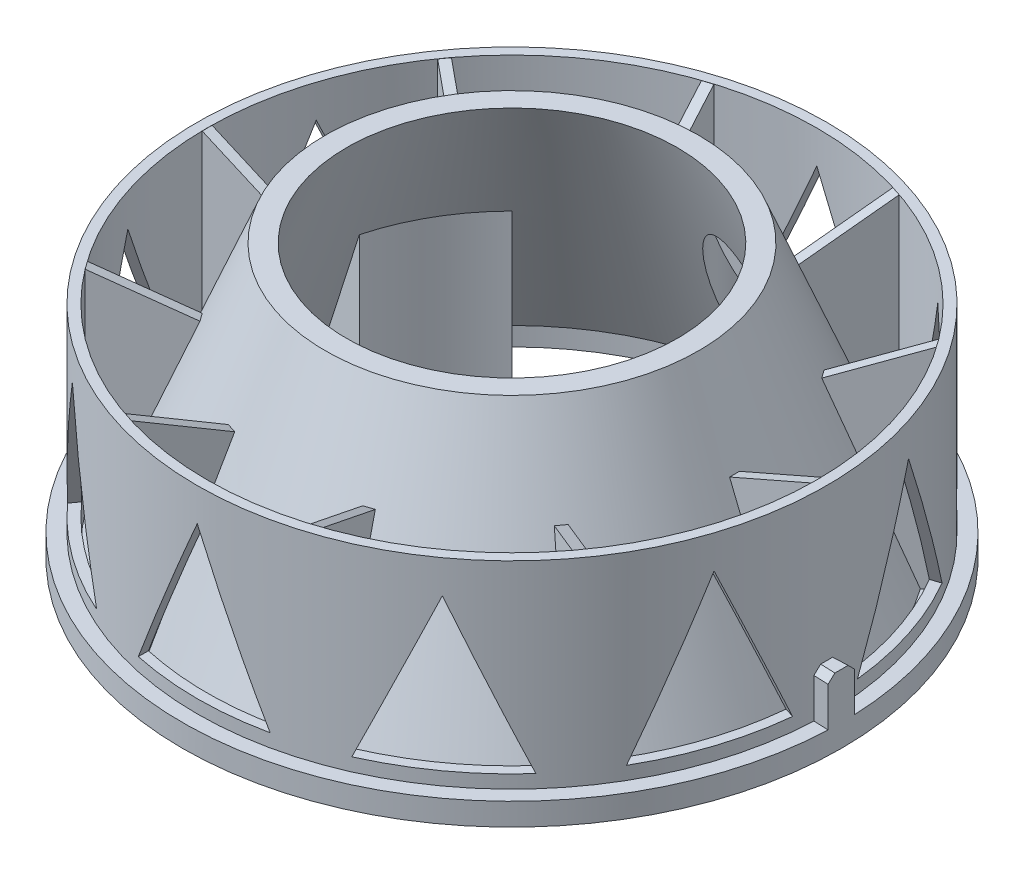
from build123d import *

# Parameters (mm, degrees)
EXTRUDE_771_DEPTH                    = 0.75
PATTERN_CIRCULAR_830_COUNT           = 10
CUT_EXTRUDE_966_DEPTH                = 37.9
CUT_EXTRUDE_966_DEPTH_BACK           = 24.5
SKETCH_3_R                           = 5
CUT_EXTRUDE_1424_DEPTH               = 3
PATTERN_CIRCULAR_2_COUNT             = 6
CUT_EXTRUDE_START                    = 45.15598
CUT_EXTRUDE_1_DEPTH                  = 2.59402
PATTERN_CIRCULAR_3_COUNT             = 10
EXTRUDE_1_DEPTH                      = 7
CHAMFER_1_SIZE                       = 1
SKETCH_8_R                           = 50
SKETCH_8_R_2                         = 45
CUT_EXTRUDE_2_DEPTH                  = 1.6
EXTRUDE_2_REACH                      = 83.24
PATTERN_CIRCULAR_4_COUNT             = 3
SKETCH_10_R                          = 2.2
CUT_EXTRUDE_3_DEPTH                  = 12
CHAMFER_2_SIZE                       = 1
PATTERN_CIRCULAR_5_COUNT             = 3
CHAMFER_2_OF_PATTERN_CIRCULAR_5_SIZE = 1
CHAMFER_3_SIZE                       = 0.4


with BuildPart() as part:
    # Эскиз1 → Повернуть1 (revolve)
    with BuildSketch(Plane.XY, mode=Mode.PRIVATE) as revolve_1_sk:
        Polygon((46.25, 35), (47.75, 35), (47.75, 5), (50, 5), (50, 0), (32.75, 0), (32.75, 3), (41.25, 3), (25.088950967, 43), (28.324555195, 43), (44.485604228, 3), (46.25, 3), align=None)
    revolve(revolve_1_sk.sketch.rotate(Axis((0, 0, 0), (0, 1, 0)), 90), axis=Axis((0, 0, 0), (0, 1, 0)))

    # Эскиз2 → Extrude 771 (add, symmetric)
    with BuildSketch(Plane.XY):
        Polygon((46.326460667, 35), (33.75500323, 29.508377561), (44.425581072, 2.377813311), (46.326460667, 2.377813311), align=None)
    extrude_771 = extrude(amount=EXTRUDE_771_DEPTH, both=True)

    # Pattern Circular 830: Extrude 771 ×10 about axis
    pattern_circular_830_axis = Axis((0, 0, 0), (0, 1, 0))
    for i in range(1, PATTERN_CIRCULAR_830_COUNT):
        add(extrude_771.rotate(pattern_circular_830_axis, i * 360 / PATTERN_CIRCULAR_830_COUNT))

    # Эскиз3 → Cut-Extrude 966 (cut, two sides: drawn at the far end of the back side and taken through both)
    with BuildSketch(Plane(origin=(0, 0, 0), x_dir=(1, 0, 0), z_dir=(0, 1, 0)).offset(-CUT_EXTRUDE_966_DEPTH_BACK)):
        with Locations(Location((0, 36, 0), (0, 0, 90.000000022))):
            Circle(SKETCH_3_R)
    extrude(amount=CUT_EXTRUDE_966_DEPTH + CUT_EXTRUDE_966_DEPTH_BACK, mode=Mode.SUBTRACT)

    # Эскиз4 → Cut-Extrude 1424 (cut)
    with BuildSketch(Plane(origin=(0, 0, 0), x_dir=(1, 0, 0), z_dir=(0, 1, 0))):
        with BuildLine():
            Line((0, 0), (-29.344931419, 29.344931419))
            ThreePointArc((-29.344931419, 29.344931419), (-20.75, 35.940054257), (-10.740990372, 40.085921791))
            Line((-10.740990372, 40.085921791), (0, 0))
        make_face()
    cut_extrude_1424 = extrude(amount=CUT_EXTRUDE_1424_DEPTH, mode=Mode.SUBTRACT)

    # Круговой массив2: Cut-Extrude 1424 ×6 about axis
    pattern_circular_2_axis = Axis((0, 0, 0), (0, 1, 0))
    for i in range(1, PATTERN_CIRCULAR_2_COUNT):
        add(cut_extrude_1424.rotate(pattern_circular_2_axis, i * 360 / PATTERN_CIRCULAR_2_COUNT), mode=Mode.SUBTRACT)

    # Эскиз5 → Вырез-Вытянуть1 (cut)
    with BuildSketch(Plane.XY.offset(CUT_EXTRUDE_START)):
        Polygon((-10, 7), (0, 30), (10, 7), align=None)
    cut_extrude_1 = extrude(amount=CUT_EXTRUDE_1_DEPTH, mode=Mode.SUBTRACT)

    # Круговой массив3: Вырез-Вытянуть1 ×10 about axis
    pattern_circular_3_axis = Axis((0, 0, 0), (0, 1, 0))
    for i in range(1, PATTERN_CIRCULAR_3_COUNT):
        add(cut_extrude_1.rotate(pattern_circular_3_axis, i * 360 / PATTERN_CIRCULAR_3_COUNT), mode=Mode.SUBTRACT)

    # Эскиз7 → Бобышка-Вытянуть1 (add)
    with BuildSketch(Plane(origin=(0, 5, 0), x_dir=(1, 0, 0), z_dir=(0, 1, 0))):
        with BuildLine():
            ThreePointArc((47.711784708, 1.91), (47.740445221, 0.955191134), (47.75, 0))
            Line((47.75, 0), (50, 0))
            ThreePointArc((50, 0), (49.989994996, 1.00020014), (49.959983987, 2))
            Line((49.959983987, 2), (47.711784708, 1.91))
        make_face()
        with BuildLine():
            Line((50, 0), (47.75, 0))
            ThreePointArc((47.75, 0), (47.740445221, -0.955191134), (47.711784708, -1.91))
            Line((47.711784708, -1.91), (49.959983987, -2))
            ThreePointArc((49.959983987, -2), (49.989994996, -1.00020014), (50, 0))
        make_face()
    extrude(amount=EXTRUDE_1_DEPTH)

    # Фаска1
    chamfer_1_edges = [part.edges().sort_by_distance(p)[0] for p in [
        (48.835884347, 12, -1.955),
        (48.835884347, 12, 1.955),
    ]]
    chamfer(chamfer_1_edges, length=CHAMFER_1_SIZE)

    # Эскиз8 → Вырез-Вытянуть2 (cut)
    with BuildSketch(Plane.XZ):
        with Locations(Location((0, 0, 0), (0, 0, 270))):
            Circle(SKETCH_8_R)
        with Locations(Location((0, 0, 0), (0, 0, 270))):
            Circle(SKETCH_8_R_2, mode=Mode.SUBTRACT)
    extrude(amount=-CUT_EXTRUDE_2_DEPTH, mode=Mode.SUBTRACT)

    # Эскиз9 → Бобышка-Вытянуть2 (add, up to next)
    with BuildSketch(Plane(origin=(0, 3, 0), x_dir=(1, 0, 0), z_dir=(0, 1, 0)), mode=Mode.PRIVATE) as extrude_2_sk1:
        with BuildLine():
            Line((31.634070811, 8.476323727), (39.844440334, 10.67628561))
            ThreePointArc((39.844440334, 10.67628561), (35.723547906, 20.625), (29.168154724, 29.168154724))
            Line((29.168154724, 29.168154724), (23.157747084, 23.157747084))
            ThreePointArc((23.157747084, 23.157747084), (28.362331974, 16.375), (31.634070811, 8.476323727))
        make_face()
    extrude_2_tool1 = extrude(extrude_2_sk1.sketch, amount=EXTRUDE_2_REACH, mode=Mode.PRIVATE) - part.part
    extrude_2 = extrude_2_tool1.solids().sort_by_distance((31.817481, 3, -18.369831))[0]
    add(extrude_2)

    # Круговой массив4: Бобышка-Вытянуть2 ×3 about axis
    pattern_circular_4_axis = Axis((0, 0, 0), (0, -1, 0))
    for i in range(1, PATTERN_CIRCULAR_4_COUNT):
        add(extrude_2.rotate(pattern_circular_4_axis, i * 360 / PATTERN_CIRCULAR_4_COUNT))

    # Эскиз10 → Вырез-Вытянуть3 (cut)
    with BuildSketch(Plane.XZ):
        with Locations(Location((0, 37.5, 0), (0, 0, 270))):
            Circle(SKETCH_10_R)
    cut_extrude_3 = extrude(amount=-CUT_EXTRUDE_3_DEPTH, mode=Mode.SUBTRACT)

    # Фаска2
    chamfer_2_edges = [part.edges().sort_by_distance(p)[0] for p in [
        (0, 0, 39.7),
    ]]
    chamfer(chamfer_2_edges, length=CHAMFER_2_SIZE)

    # Круговой массив5: Вырез-Вытянуть3 ×3 about axis
    pattern_circular_5_axis = Axis((0, 0, 0), (0, 1, 0))
    for i in range(1, PATTERN_CIRCULAR_5_COUNT):
        add(cut_extrude_3.rotate(pattern_circular_5_axis, i * 360 / PATTERN_CIRCULAR_5_COUNT), mode=Mode.SUBTRACT)

    # Фаска2 of Круговой массив5
    chamfer_2_of_pattern_circular_5_edges = [part.edges().sort_by_distance(p)[0] for p in [
        (34.38120853, 0, -19.85),
        (-34.38120853, 0, -19.85),
    ]]
    chamfer(chamfer_2_of_pattern_circular_5_edges, length=CHAMFER_2_OF_PATTERN_CIRCULAR_5_SIZE)

    # Фаска3
    chamfer_3_edges = [part.edges().sort_by_distance(p)[0] for p in [
        (0, 0, 45),
    ]]
    chamfer(chamfer_3_edges, length=CHAMFER_3_SIZE)


solid = part.part
